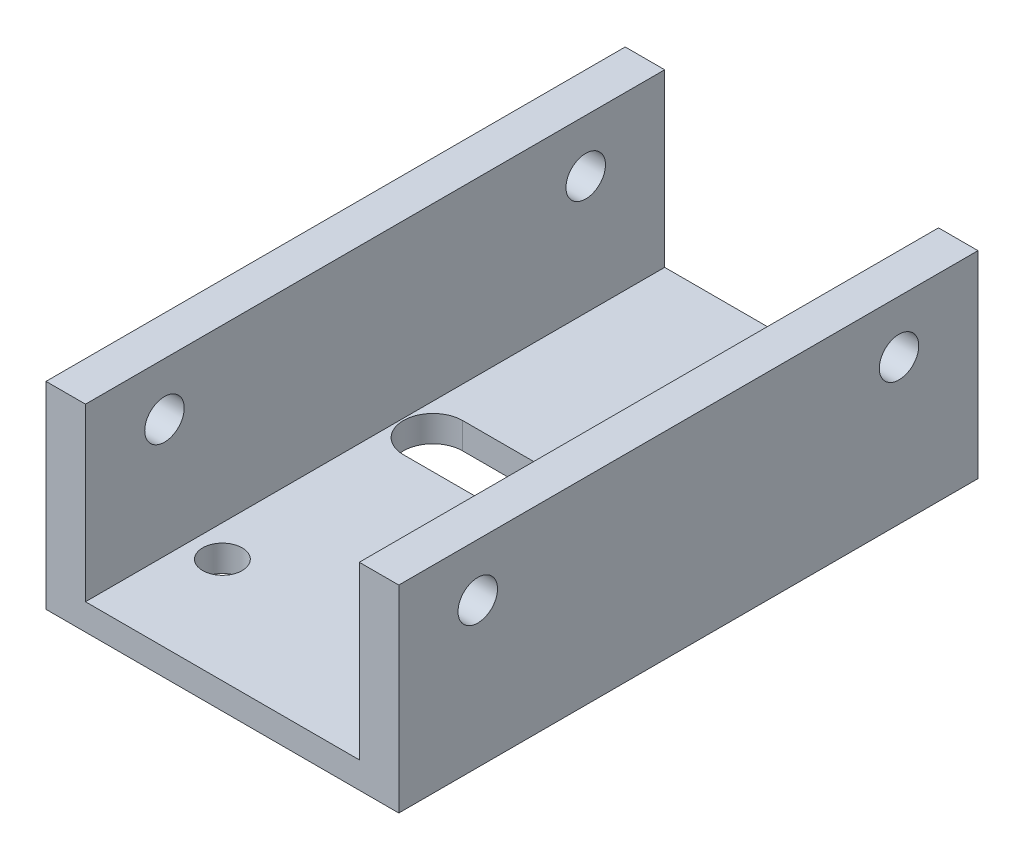
from build123d import *

# Parameters (mm, degrees)
BOSS_EXTRUDE1_DEPTH = 44
SKETCH3_R           = 1.5
CUT_EXTRUDE1_DEPTH  = 30
SKETCH4_R           = 1.5
CUT_EXTRUDE2_DEPTH  = 30


with BuildPart() as part:
    # Sketch2 → Boss-Extrude1 (new body)
    with BuildSketch(Plane.XY):
        Polygon((23.8, 15), (26.8, 15), (26.8, 0), (0, 0), (0, 15), (3, 15), (3, 2), (23.8, 2), align=None)
    extrude(amount=BOSS_EXTRUDE1_DEPTH)

    # Sketch3 → Cut-Extrude1 (cut)
    with BuildSketch(Plane.XZ):
        with Locations((21.4, 36)):
            Circle(SKETCH3_R)
        with Locations((13.4, 8)):
            Circle(SKETCH3_R)
        with Locations((5.4, 36)):
            Circle(SKETCH3_R)
        with BuildLine():
            Line((21.4, 17.75), (5.4, 17.75))
            ThreePointArc((5.4, 17.75), (3.15, 20), (5.4, 22.25))
            Line((5.4, 22.25), (21.4, 22.25))
            ThreePointArc((21.4, 22.25), (23.65, 20), (21.4, 17.75))
        make_face()
    extrude(amount=-CUT_EXTRUDE1_DEPTH, mode=Mode.SUBTRACT)

    # Sketch4 → Cut-Extrude2 (cut)
    with BuildSketch(Plane.ZY):
        with Locations((6, 11)):
            Circle(SKETCH4_R)
        with Locations((38, 11)):
            Circle(SKETCH4_R)
    extrude(amount=-CUT_EXTRUDE2_DEPTH, mode=Mode.SUBTRACT)


solid = part.part
